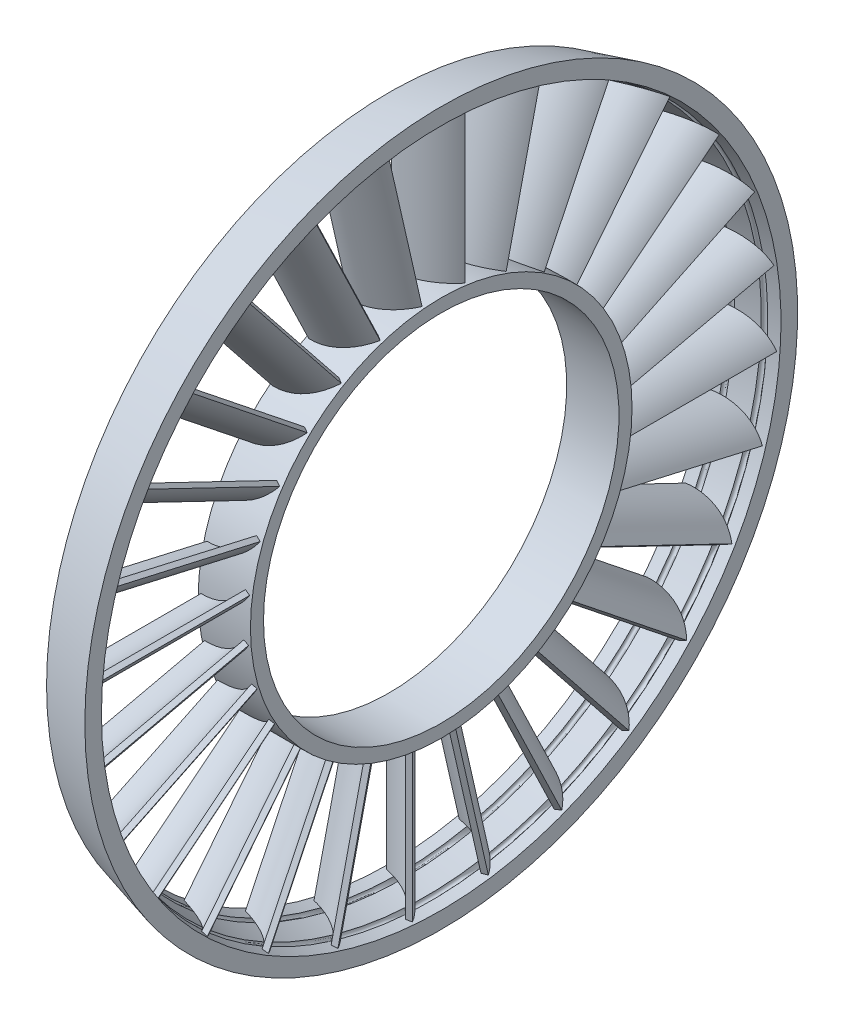
from build123d import *

# Parameters (mm, degrees)
SKETCH1_W           = 20
SKETCH1_H           = 5
EXTRUDE_THIN1_REACH = 195.1
CIRPATTERN1_COUNT   = 28
SKETCH5_R           = 68
CUT_EXTRUDE1_DEPTH  = 40


with BuildPart() as part:
    # Sketch1 → Revolve1 (revolve)
    with BuildSketch(Plane.XY):
        with Locations((0, 70.5)):
            Rectangle(SKETCH1_W, SKETCH1_H)
        with BuildLine():
            Line((-10, 131), (10, 136.358983849))
            Line((10, 136.358983849), (10, 129.998983849))
            Line((10, 129.998983849), (5.965925826, 128.918056932))
            ThreePointArc((5.965925826, 128.918056932), (4.741180955, 129.625163713), (4.034074174, 128.400418841))
            Line((4.034074174, 128.400418841), (-4.034074174, 126.238565007))
            ThreePointArc((-4.034074174, 126.238565007), (-5.258819045, 126.945671788), (-5.965925826, 125.720926917))
            Line((-5.965925826, 125.720926917), (-10, 124.64))
            Line((-10, 124.64), (-10, 131))
        make_face()
    revolve(axis=Axis((-41.248022202, 0, 0), (1, 0, 0)))

    # Extrude-Thin1: up to this cone (the profile starts inside it)
    extrude_thin1_end = Plane(origin=(0.457375, 0, 0), z_dir=(1, 0, 0)) * Cone(40.883190057, 214.000900315, 646.084090372, mode=Mode.PRIVATE)
    # Sketch4 → Extrude-Thin1 (add, up to the surface)
    with BuildSketch(Plane.XY, mode=Mode.PRIVATE) as extrude_thin1_sk1:
        with BuildLine():
            ThreePointArc((-9, 0), (1.374647023, -2.525635359), (9, -10))
            Line((9, -10), (7.271457673, -11.006052396))
            ThreePointArc((7.271457673, -11.006052396), (0.40336116, -4.273949911), (-8.941003257, -1.999129657))
            Line((-8.941003257, -1.999129657), (-9, 0))
        make_face()
    extrude_thin1_tool1 = extrude(extrude_thin1_sk1.sketch, amount=-EXTRUDE_THIN1_REACH, mode=Mode.PRIVATE) & extrude_thin1_end
    extrude_thin1 = extrude_thin1_tool1.solids().sort_by_distance((0.457375, -4.176724, 0))[0]
    add(extrude_thin1)

    # CirPattern1: Extrude-Thin1 ×28 about axis
    cirpattern1_axis = Axis((-41.248022202, 0, 0), (-1, 0, 0))
    for i in range(1, CIRPATTERN1_COUNT):
        add(extrude_thin1.rotate(cirpattern1_axis, i * 360 / CIRPATTERN1_COUNT))

    # Sketch5 → Cut-Extrude1 (cut, symmetric)
    with BuildSketch(Plane(origin=(0, 0, 0), x_dir=(0, 0, -1), z_dir=(1, 0, 0))):
        Circle(SKETCH5_R)
    extrude(amount=CUT_EXTRUDE1_DEPTH, both=True, mode=Mode.SUBTRACT)


solid = part.part
